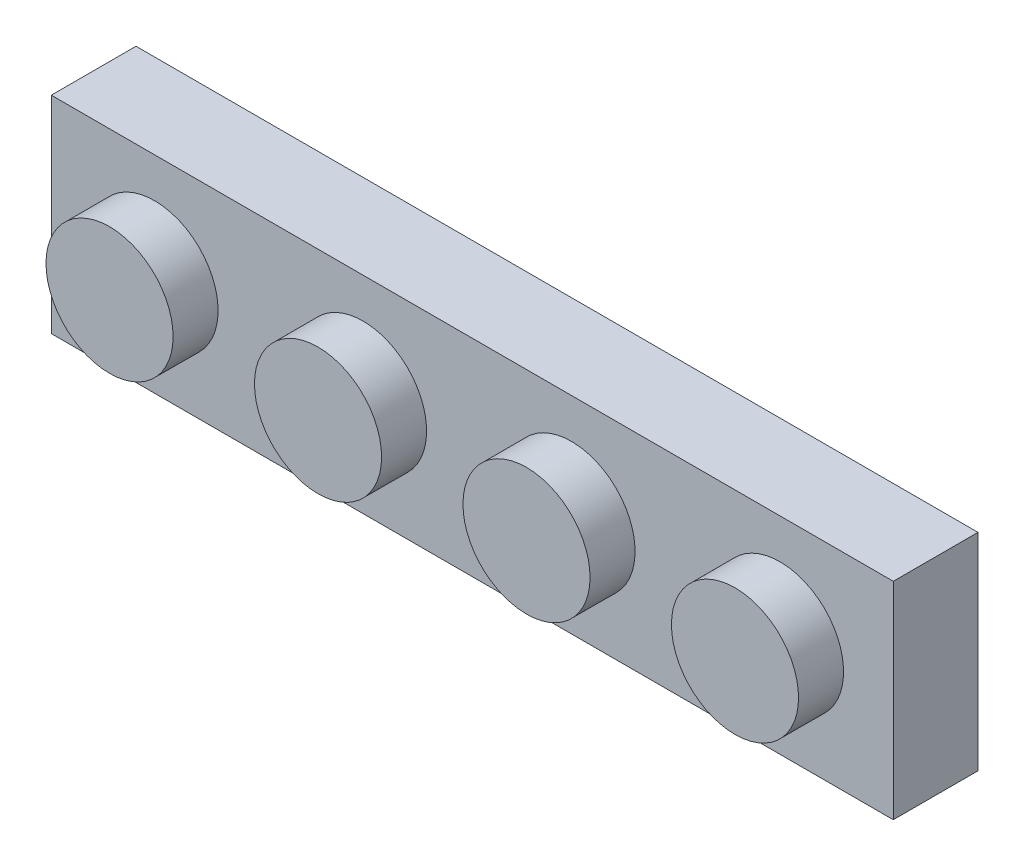
from build123d import *

# Parameters (mm, degrees)
SKETCH_1_W          = 31.8
SKETCH_1_H          = 7.8
EXTRUDE_1_DEPTH     = 3.2
SKETCH_2_R          = 2.4
EXTRUDE_2_DEPTH     = 1.7
SKETCH_3_R          = 2.5
CUT_EXTRUDE_1_DEPTH = 1.8


with BuildPart() as part:
    # Эскиз1 → Бобышка-Вытянуть1 (new body)
    with BuildSketch(Plane.XY):
        Rectangle(SKETCH_1_W, SKETCH_1_H)
    extrude(amount=EXTRUDE_1_DEPTH)

    # Эскиз2 → Бобышка-Вытянуть2 (add)
    with BuildSketch(Plane.XY.offset(3.2)):
        with Locations((-12, 0)):
            Circle(SKETCH_2_R)
        with Locations((-4.126, 0)):
            Circle(SKETCH_2_R)
        with Locations((3.748, 0)):
            Circle(SKETCH_2_R)
        with Locations((11.622, 0)):
            Circle(SKETCH_2_R)
    extrude(amount=EXTRUDE_2_DEPTH)

    # Эскиз3 → Вырез-Вытянуть1 (cut)
    with BuildSketch(Plane(origin=(0, 0, 0), x_dir=(-1, 0, 0), z_dir=(0, 0, -1))):
        with Locations((-12, 0)):
            Circle(SKETCH_3_R)
        with Locations((-4.126, 0)):
            Circle(SKETCH_3_R)
        with Locations((3.748, 0)):
            Circle(SKETCH_3_R)
        with Locations((11.622, 0)):
            Circle(SKETCH_3_R)
    extrude(amount=-CUT_EXTRUDE_1_DEPTH, mode=Mode.SUBTRACT)


solid = part.part
